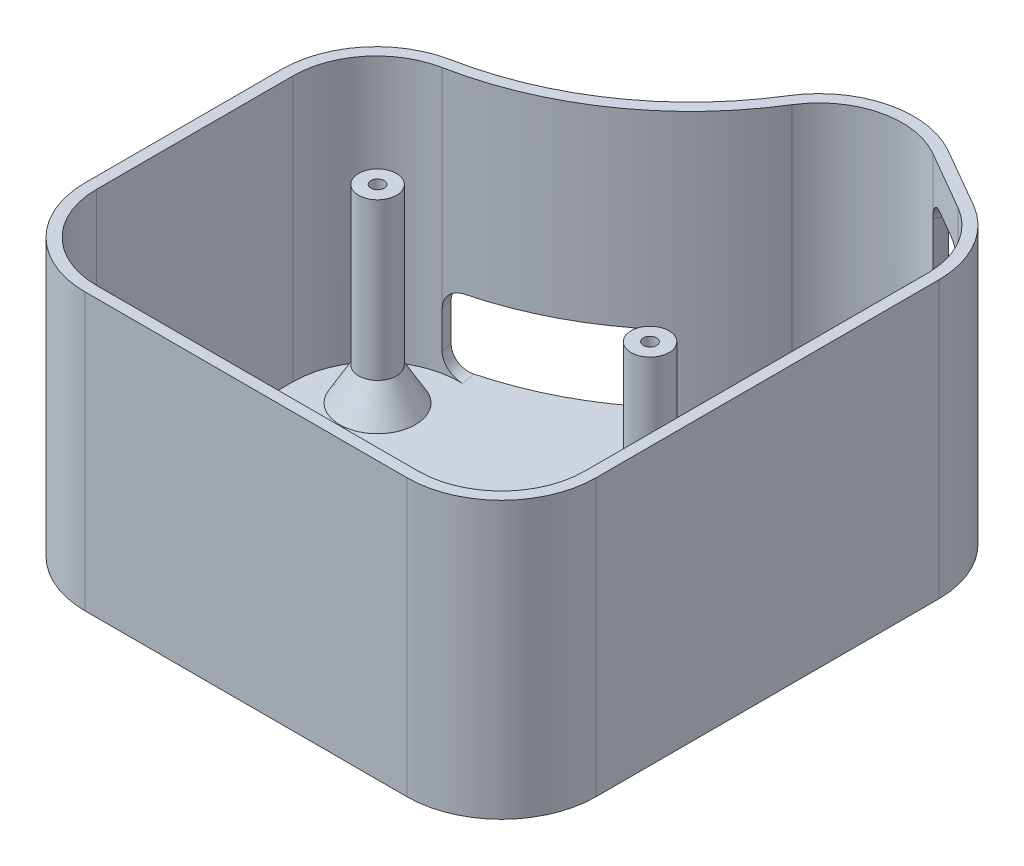
from build123d import *

# Parameters (mm, degrees)
SKETCH1_W           = 260
SKETCH1_H           = 100
BOSS_EXTRUDE1_DEPTH = 3
CUT_EXTRUDE1_DEPTH  = 5
SKETCH5_W           = 260
SKETCH5_H           = 80
BOSS_EXTRUDE4_DEPTH = 3
BOSS_EXTRUDE5_START = 70
BOSS_EXTRUDE5_DEPTH = 70
BOSS_EXTRUDE6_DEPTH = 70
CUT_EXTRUDE3_DEPTH  = 198.810515393
SKETCH10_R          = 5
SKETCH10_R_2        = 1.75
BOSS_EXTRUDE7_DEPTH = 50
CHAMFER1_SIZE       = 5
CHAMFER1_SIZE2      = 8.660254038
FILLET1_R           = 22
FILLET2_R           = 25
CUT_EXTRUDE4_START  = 20
CUT_EXTRUDE4_DEPTH  = 20
SKETCH12_R          = 1.75
CUT_EXTRUDE5_DEPTH  = 20
CUT_EXTRUDE6_DEPTH  = 40
FILLET3_R           = 5


with BuildPart() as part:
    # Sketch1 → Boss-Extrude1 (new body)
    with BuildSketch(Plane(origin=(0, 0, 0), x_dir=(1, 0, 0), z_dir=(0, 1, 0))):
        Rectangle(SKETCH1_W, SKETCH1_H)
    extrude(amount=BOSS_EXTRUDE1_DEPTH)

    # Sketch4 → Cut-Extrude1 (cut)
    with BuildSketch(Plane(origin=(0, 3, 0), x_dir=(1, 0, 0), z_dir=(0, 1, 0))):
        with BuildLine():
            Line((-77.534249575, 30.291115131), (-130, 0))
            Line((-130, 0), (-130, 50))
            Line((-130, 50), (130, 50))
            Line((130, 50), (130, 0))
            Line((130, 0), (77.534249575, 30.291115131))
            ThreePointArc((77.534249575, 30.291115131), (0, -30), (-77.534249575, 30.291115131))
        make_face()
    extrude(amount=-CUT_EXTRUDE1_DEPTH, mode=Mode.SUBTRACT)

    # Sketch5 → Boss-Extrude4 (add)
    with BuildSketch(Plane(origin=(0, 3, 0), x_dir=(1, 0, 0), z_dir=(0, 1, 0))):
        with Locations((0, -90)):
            Rectangle(SKETCH5_W, SKETCH5_H)
    extrude(amount=-BOSS_EXTRUDE4_DEPTH)

    # Sketch6 → Boss-Extrude5 (add)
    with BuildSketch(Plane(origin=(0, 3, 0), x_dir=(1, 0, 0), z_dir=(0, 1, 0)).offset(BOSS_EXTRUDE5_START)):
        with BuildLine():
            Line((-77.534249575, 30.291115131), (-130, 0))
            Line((-130, 0), (-130, -130))
            Line((-130, -130), (130, -130))
            Line((130, -130), (130, 0))
            Line((130, 0), (77.534249575, 30.291115131))
            ThreePointArc((77.534249575, 30.291115131), (0, -30), (-77.534249575, 30.291115131))
        make_face()
        with BuildLine():
            Line((-79.381629809, 25.76042804), (-127, -1.732050808))
            Line((-127, -1.732050808), (-127, -127))
            Line((-127, -127), (127, -127))
            Line((127, -127), (127, -1.732050808))
            Line((127, -1.732050808), (79.381629809, 25.76042804))
            ThreePointArc((79.381629809, 25.76042804), (0, -33), (-79.381629809, 25.76042804))
        make_face(mode=Mode.SUBTRACT)
    extrude(amount=-BOSS_EXTRUDE5_DEPTH)

    # Sketch7 → Boss-Extrude6 (add)
    with BuildSketch(Plane(origin=(0, 73, 0), x_dir=(1, 0, 0), z_dir=(0, 1, 0))):
        with BuildLine():
            Line((-5, -32.849260709), (-5, -130))
            Line((-5, -130), (-2, -130))
            Line((-2, -130), (-2, -32.975900116))
            ThreePointArc((-2, -32.975900116), (-3.500572722, -32.92614781), (-5, -32.849260709))
        make_face()
    extrude(amount=-BOSS_EXTRUDE6_DEPTH)

    # Sketch9 → Cut-Extrude3 (cut, through all)
    with BuildSketch(Plane(origin=(0, 73, 0), x_dir=(1, 0, 0), z_dir=(0, 1, 0))):
        Polygon((-5, -32.849260709), (-5, -144.876678539), (-379.728059333, -144.876678539), (-379.728059333, 52.069032857), (-5, 52.069032857), align=None)
    extrude(amount=-CUT_EXTRUDE3_DEPTH, mode=Mode.SUBTRACT)

    # Sketch10 → Boss-Extrude7 (add)
    # profile 1 of 4: a face of its own
    with BuildSketch(Plane(origin=(0, 3, 0), x_dir=(1, 0, 0), z_dir=(0, 1, 0))):
        with Locations(Location((14, -46.75, 0), (0, 0, 90))):
            Circle(SKETCH10_R)
        with Locations(Location((14, -46.75, 0), (0, 0, 270))):
            Circle(SKETCH10_R_2, mode=Mode.SUBTRACT)
    # profile 2 of 4: a face of its own
    with BuildSketch(Plane(origin=(0, 3, 0), x_dir=(1, 0, 0), z_dir=(0, 1, 0))):
        with Locations(Location((86, -46.75, 0), (0, 0, 90))):
            Circle(SKETCH10_R)
        with Locations(Location((86, -46.75, 0), (0, 0, 270))):
            Circle(SKETCH10_R_2, mode=Mode.SUBTRACT)
    # profile 3 of 4: a face of its own
    with BuildSketch(Plane(origin=(0, 3, 0), x_dir=(1, 0, 0), z_dir=(0, 1, 0))):
        with Locations(Location((86, -113.25, 0), (0, 0, 90))):
            Circle(SKETCH10_R)
        with Locations(Location((86, -113.25, 0), (0, 0, 270))):
            Circle(SKETCH10_R_2, mode=Mode.SUBTRACT)
    # profile 4 of 4: a face of its own
    with BuildSketch(Plane(origin=(0, 3, 0), x_dir=(1, 0, 0), z_dir=(0, 1, 0))):
        with Locations(Location((14, -113.25, 0), (0, 0, 90))):
            Circle(SKETCH10_R)
        with Locations(Location((14, -113.25, 0), (0, 0, 270))):
            Circle(SKETCH10_R_2, mode=Mode.SUBTRACT)
    extrude(amount=BOSS_EXTRUDE7_DEPTH)

    # Chamfer1
    chamfer1_edges = [part.edges().sort_by_distance(p)[0] for p in [
        (86, 3, 51.75),
        (14, 3, 51.75),
        (86, 3, 118.25),
        (14, 3, 118.25),
    ]]
    chamfer1_side = [part.faces().sort_by_distance(p)[0] for p in [
        (68.049806081, 3, 64.998636776),
    ]]
    chamfer(chamfer1_edges, length=CHAMFER1_SIZE, length2=CHAMFER1_SIZE2, reference=chamfer1_side[0])

    # Fillet1
    fillet1_edges = [part.edges().sort_by_distance(p)[0] for p in [
        (-2, 38, 127),
        (-2, 38, 32.975900116),
        (127, 38, 127),
        (127, 38, 1.732050808),
        (79.381629809, 38, -25.76042804),
    ]]
    fillet(fillet1_edges, radius=FILLET1_R)

    # Fillet2
    fillet2_edges = [part.edges().sort_by_distance(p)[0] for p in [
        (-5, 36.5, 29.843597113),
        (-5, 36.5, 130),
        (77.534249575, 36.5, -30.291115131),
        (130, 36.5, 0),
        (130, 36.5, 130),
    ]]
    fillet(fillet2_edges, radius=FILLET2_R)

    # Sketch11 → Cut-Extrude4 (cut)
    with BuildSketch(Plane(origin=(0, 3, 0), x_dir=(1, 0, 0), z_dir=(0, 1, 0)).offset(CUT_EXTRUDE4_START)):
        with BuildLine():
            Line((52.464250206, -10.394556462), (54.431659589, -12.65935233))
            ThreePointArc((54.431659589, -12.65935233), (36.359512028, -24.612236832), (15.80952381, -31.480420697))
            Line((15.80952381, -31.480420697), (15.238095238, -28.53534525))
            ThreePointArc((15.238095238, -28.53534525), (35.045312798, -21.915408995), (52.464250206, -10.394556462))
        make_face()
        Polygon((101.737077009, 16.317606197), (100.237077009, 13.719529986), (116, 4.618802154), (117.5, 7.216878365), align=None)
    extrude(amount=-CUT_EXTRUDE4_DEPTH, mode=Mode.SUBTRACT)

    # Sketch12 → Cut-Extrude5 (cut)
    with BuildSketch(Plane(origin=(0, 3, 0), x_dir=(1, 0, 0), z_dir=(0, 1, 0))):
        with Locations(Location((89.237077009, -5.333028897, 0), (0, 0, 270))):
            Circle(SKETCH12_R)
        with Locations(Location((105, -105, 0), (0, 0, 270))):
            Circle(SKETCH12_R)
        with Locations(Location((15, -105, 0), (0, 0, 66.494954424))):
            Circle(SKETCH12_R)
        with Locations(Location((15, -55, 0), (0, 0, 260.317408662))):
            Circle(SKETCH12_R)
    extrude(amount=-CUT_EXTRUDE5_DEPTH, mode=Mode.SUBTRACT)

    # Sketch14 → Cut-Extrude6 (cut)
    with BuildSketch(Plane.XZ.offset(-23)):
        Polygon((101.737077009, -16.317606197), (117.5, -7.216878365), (116, -4.618802154), (100.237077009, -13.719529986), align=None)
    extrude(amount=-CUT_EXTRUDE6_DEPTH, mode=Mode.SUBTRACT)

    # Fillet3
    # the kernel refuses this fillet: 5 mm, written as the material it adds along each edge
    with BuildSketch(Plane(origin=(101.737077009, 3, -16.317606197), x_dir=(0.8660254037844373, 0, 0.5000000000000024), z_dir=(-0.5000000000000026, 0, 0.8660254037844373))) as fillet3_piece_1_section:
        with BuildLine():
            CenterArc((FILLET3_R, FILLET3_R), FILLET3_R, 180, 90)
            Line((0, FILLET3_R), (0, 0))
            Line((0, 0), (FILLET3_R, 0))
        make_face()
    fillet3_piece_1 = extrude(amount=15.5, mode=Mode.PRIVATE)
    fillet3_piece_1 = fillet3_piece_1 - Plane(origin=(89.237077009, 3.433810283, 5.333028897), x_dir=(-0.8498769238912803, 0, -0.5269812275945843), z_dir=(0, -1, 0)) * Cylinder(22, 52, mode=Mode.PRIVATE)
    add(fillet3_piece_1)
    with BuildSketch(Plane(origin=(109.75, 3, 6.206515394), x_dir=(-0.8660254037844346, 0, -0.500000000000007), z_dir=(0.500000000000007, 0, -0.8660254037844346))) as fillet3_piece_2_section:
        with BuildLine():
            CenterArc((FILLET3_R, FILLET3_R), FILLET3_R, 180, 90)
            Line((0, FILLET3_R), (0, 0))
            Line((0, 0), (FILLET3_R, 0))
        make_face()
    fillet3_piece_2 = extrude(amount=15.5, mode=Mode.PRIVATE)
    fillet3_piece_2 = fillet3_piece_2 - Plane(origin=(105, 4.115508028, 14.43375673), x_dir=(0.5000000000000037, 0, -0.8660254037844366), z_dir=(0, -1, 0)) * Cylinder(22, 51, mode=Mode.PRIVATE)
    add(fillet3_piece_2)
    with BuildSketch(Plane(origin=(44.266711112, 3, 0.957907015), x_dir=(-0.754931955778907, 0, 0.6558031275800951), z_dir=(0.6558031275800951, 0, 0.754931955778907))) as fillet3_piece_3_section:
        with BuildLine():
            CenterArc((FILLET3_R, -FILLET3_R), FILLET3_R, 90, 90)
            Line((0, -FILLET3_R), (0, 0))
            Line((0, 0), (FILLET3_R, 0))
        make_face()
    fillet3_piece_3 = extrude(amount=28, mode=Mode.PRIVATE)
    fillet3_piece_3 = fillet3_piece_3 & Plane(origin=(0, 4.116736713, -50), x_dir=(0.9564051784275456, 0, 0.2920430356590872), z_dir=(0, 1, 0)) * Cylinder(83, 77, mode=Mode.PRIVATE)
    fillet3_piece_3 = fillet3_piece_3 - Plane(origin=(0, 4.116736713, -50), x_dir=(0.9691781196921706, 0, 0.2463610608638238), z_dir=(0, 1, 0)) * Cylinder(80, 77, mode=Mode.PRIVATE)
    add(fillet3_piece_3)
    with BuildSketch(Plane(origin=(18.19047619, 3, 43.751568392), x_dir=(0.9816918156232519, 0, -0.19047619047619338), z_dir=(-0.19047619047619338, 0, -0.981691815623252))) as fillet3_piece_4_section:
        with BuildLine():
            CenterArc((FILLET3_R, -FILLET3_R), FILLET3_R, 90, 90)
            Line((0, -FILLET3_R), (0, 0))
            Line((0, 0), (FILLET3_R, 0))
        make_face()
    fillet3_piece_4 = extrude(amount=28, mode=Mode.PRIVATE)
    fillet3_piece_4 = fillet3_piece_4 - Plane(origin=(20, 4.115502573, 53.07764064), x_dir=(-0.19047619047619013, 0, -0.9816918156232526), z_dir=(0, -1, 0)) * Cylinder(22, 77, mode=Mode.PRIVATE)
    fillet3_piece_4 = fillet3_piece_4 - Plane(origin=(0, 4.115502573, -50), x_dir=(0.9691781196921706, 0, 0.2463610608638238), z_dir=(0, 1, 0)) * Cylinder(80, 77, mode=Mode.PRIVATE)
    add(fillet3_piece_4)
    with BuildSketch(Plane(origin=(44.266711112, 23, 0.957907015), x_dir=(-0.754931955778907, 0, 0.6558031275800951), z_dir=(0.6558031275800951, 0, 0.754931955778907))) as fillet3_piece_5_section:
        with BuildLine():
            CenterArc((FILLET3_R, FILLET3_R), FILLET3_R, 180, 90)
            Line((0, FILLET3_R), (0, 0))
            Line((0, 0), (FILLET3_R, 0))
        make_face()
    fillet3_piece_5 = extrude(amount=28, mode=Mode.PRIVATE)
    fillet3_piece_5 = fillet3_piece_5 & Plane(origin=(0, 21.883263287, -50), x_dir=(0.9564051784275456, 0, 0.2920430356590872), z_dir=(0, 1, 0)) * Cylinder(83, 77, mode=Mode.PRIVATE)
    fillet3_piece_5 = fillet3_piece_5 - Plane(origin=(0, 21.883263287, -50), x_dir=(0.9691781196921706, 0, 0.2463610608638238), z_dir=(0, 1, 0)) * Cylinder(80, 77, mode=Mode.PRIVATE)
    add(fillet3_piece_5)
    with BuildSketch(Plane(origin=(18.19047619, 23, 43.751568392), x_dir=(0, -1, 0), z_dir=(-0.19047619047619338, 0, -0.981691815623252))) as fillet3_piece_6_section:
        with BuildLine():
            CenterArc((FILLET3_R, -FILLET3_R), FILLET3_R, 90, 90)
            Line((0, -FILLET3_R), (0, 0))
            Line((0, 0), (FILLET3_R, 0))
        make_face()
    fillet3_piece_6 = extrude(amount=28, mode=Mode.PRIVATE)
    fillet3_piece_6 = fillet3_piece_6 & Plane(origin=(0, 21.870297326, -50), x_dir=(0.9564051784275456, 0, 0.2920430356590872), z_dir=(0, 1, 0)) * Cylinder(83, 77, mode=Mode.PRIVATE)
    fillet3_piece_6 = fillet3_piece_6 - Plane(origin=(0, 21.870297326, -50), x_dir=(0.9691781196921706, 0, 0.2463610608638238), z_dir=(0, 1, 0)) * Cylinder(80, 77, mode=Mode.PRIVATE)
    add(fillet3_piece_6)
    with BuildSketch(Plane(origin=(100.237077009, 63, -13.719529986), x_dir=(0.866025403784437, 0, 0.5000000000000028), z_dir=(0.5000000000000028, 0, -0.866025403784437))) as fillet3_piece_7:
        with BuildLine():
            CenterArc((FILLET3_R, FILLET3_R), FILLET3_R, 180, 90)
            Line((0, FILLET3_R), (0, 0))
            Line((0, 0), (FILLET3_R, 0))
        make_face()
    extrude(amount=3)
    with BuildSketch(Plane(origin=(117.5, 63, -7.216878365), x_dir=(0, -1, 0), z_dir=(-0.500000000000007, 0, 0.8660254037844346))) as fillet3_piece_8:
        with BuildLine():
            CenterArc((FILLET3_R, -FILLET3_R), FILLET3_R, 90, 90)
            Line((0, -FILLET3_R), (0, 0))
            Line((0, 0), (FILLET3_R, 0))
        make_face()
    extrude(amount=3)


solid = part.part
